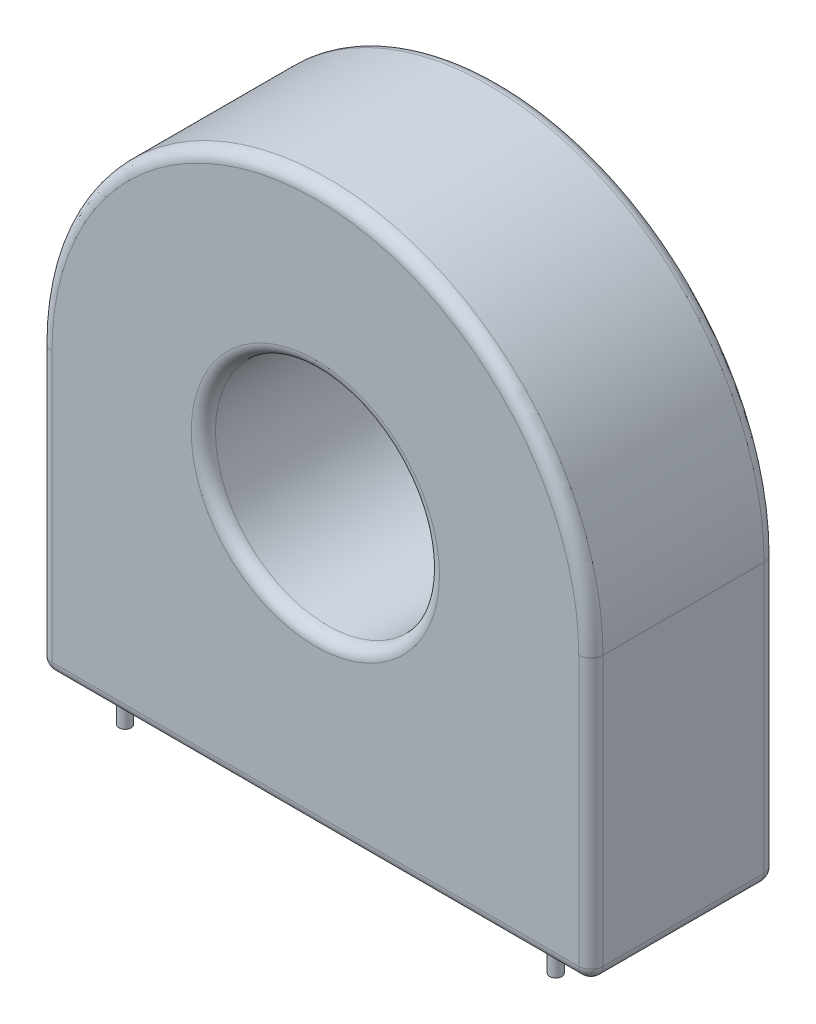
from build123d import *

# Parameters (mm, degrees)
SKETCH1_R           = 9.25
BOSS_EXTRUDE1_DEPTH = 7.65
SKETCH2_R           = 0.5
BOSS_EXTRUDE2_DEPTH = 2.5
FILLET1_R           = 1
SKETCH3_W           = 0.895944424
SKETCH3_H           = 4
SKETCH3_W_2         = 1.965215774
SKETCH3_H_2         = 0.500882695
CUT_EXTRUDE1_DEPTH  = 0.01
SKETCH4_W           = 0.682539037
SKETCH4_H           = 0.809522518
SKETCH4_W_2         = 0.682539036
SKETCH4_H_2         = 0.809522517
CUT_EXTRUDE2_DEPTH  = 0.01


with BuildPart() as part:
    # Sketch1 → Boss-Extrude1 (new, symmetric)
    with BuildSketch(Plane.XY):
        with BuildLine():
            Line((-22.75, 11.625), (-22.75, -11.625))
            Line((-22.75, -11.625), (22.75, -11.625))
            Line((22.75, -11.625), (22.75, 11.625))
            ThreePointArc((22.75, 11.625), (0, 34.375), (-22.75, 11.625))
        make_face()
        with Locations((0, 11.625)):
            Circle(SKETCH1_R, mode=Mode.SUBTRACT)
    extrude(amount=BOSS_EXTRUDE1_DEPTH, both=True)

    # Sketch2 → Boss-Extrude2 (add, symmetric)
    with BuildSketch(Plane.XZ.offset(11.625)):
        with Locations((17.78, 5.58)):
            Circle(SKETCH2_R)
        with Locations((0, -4.58)):
            Circle(SKETCH2_R)
        with Locations((-17.78, 5.58)):
            Circle(SKETCH2_R)
    extrude(amount=BOSS_EXTRUDE2_DEPTH, both=True)

    # Fillet1
    fillet1_edges = [part.edges().sort_by_distance(p)[0] for p in [
        (-22.75, 0, -7.65),
        (0, 34.375, -7.65),
        (22.75, 0, 7.65),
        (-22.75, 0, 7.65),
        (-22.75, -11.625, 0),
        (22.75, -11.625, 0),
        (0, -11.625, -7.65),
        (0, -11.625, 7.65),
        (22.75, 0, -7.65),
        (0, 34.375, 7.65),
        (-9.25, 11.625, 7.65),
    ]]
    fillet(fillet1_edges, radius=FILLET1_R)

    # Sketch3 → Cut-Extrude1 (cut)
    # profile 1 of 17: a face of its own
    with BuildSketch(Plane.XY.offset(-7.65)):
        Polygon((-8.243385382, -3.852442817), (-9.139329806, -3.852442817), (-9.139329806, -0.943216627), (-11.623966601, -3.852442817), (-12.582009721, -3.852442817), (-12.582009721, 0.147557183), (-11.686065297, 0.147557183), (-11.686065297, -2.761482996), (-9.201445726, 0.147557183), (-8.243385382, 0.147557183), align=None)
    # profile 2 of 17: a face of its own
    with BuildSketch(Plane.XY.offset(-7.65)):
        with Locations((-7.393297629, -1.852442817)):
            Rectangle(SKETCH3_W, SKETCH3_H)
    # profile 3 of 17: a face of its own
    with BuildSketch(Plane.XY.offset(-7.65)):
        Polygon((-2.768958574, -3.852441956), (-6.834476962, -3.852441956), (-6.834476962, -3.351560122), (-3.664902998, -3.351560122), (-3.664902998, 0.147557183), (-2.768958574, 0.147557183), align=None)
    # profile 4 of 17: a face of its own
    with BuildSketch(Plane.XY.offset(-7.65)):
        with Locations((-0.282186518, -1.852442817)):
            Rectangle(SKETCH3_W, SKETCH3_H)
    # profile 5 of 17: a face of its own
    with BuildSketch(Plane.XY.offset(-7.65)):
        Polygon((5.244161293, -3.852442817), (4.329861111, -3.852442817), (3.769090333, -2.723695022), (1.66010458, -2.723695022), (1.099333802, -3.852442817), (0.18503362, -3.852442817), (2.19649402, 0.147557183), (3.232700893, 0.147557183), align=None)
        Polygon((3.506990947, -2.222812327), (2.714597456, -0.642503409), (1.922203965, -2.222812327), align=None, mode=Mode.SUBTRACT)
    # profile 6 of 17: a face of its own
    with BuildSketch(Plane.XY.offset(-7.65)):
        Polygon((9.590829785, -3.852442817), (8.694885362, -3.852442817), (8.694885362, -1.877134176), (6.14814987, -1.877134176), (6.14814987, -3.852442817), (5.252205447, -3.852442817), (5.252205447, 0.147557183), (6.14814987, 0.147557183), (6.14814987, -1.37625148), (8.694885362, -1.37625148), (8.694885362, 0.147557183), (9.590829785, 0.147557183), align=None)
    # profile 7 of 17: a face of its own
    with BuildSketch(Plane.XY.offset(-7.65)):
        Polygon((14.532518498, -0.353325513), (12.582011443, -0.353325513), (12.582011443, -3.852442817), (11.686067881, -3.852442817), (11.686067881, -0.353325513), (9.735560826, -0.353325513), (9.735560826, 0.147557183), (14.532518498, 0.147557183), align=None)
    # profile 8 of 17: a face of its own
    with BuildSketch(Plane.XY.offset(-7.65)):
        with BuildLine():
            add(Edge.make_bspline(
                [(-14.092768959, -8.387409611), (-14.093682359, -8.416798847), (-14.095444674, -8.473502486), (-14.107040039, -8.555298605), (-14.125683506, -8.631229451), (-14.151024529, -8.701754478), (-14.183558361, -8.767078187), (-14.224942542, -8.825300742), (-14.271907298, -8.879214637), (-14.326767489, -8.926585214), (-14.38808482, -8.967933996), (-14.454750326, -9.004373318), (-14.52729125, -9.03541708), (-14.606060265, -9.059642085), (-14.69033939, -9.079109265), (-14.780196049, -9.093183874), (-14.875991171, -9.100984664), (-14.941667322, -9.101946627), (-14.975485009, -9.102441956)],
                knots=[0, 0, 0, 0, 1.091324182, 2.105602559, 3.061388645, 3.990302777, 4.883708783, 5.761913066, 6.63583257, 7.533363956, 8.444729669, 9.377803759, 10.351071984, 11.369571165, 12.434066396, 13.5611468, 14.744196001, 16, 16, 16, 16], degree=3))
            Line((-14.975485009, -9.102441956), (-16.973509493, -9.102441956))
            add(Edge.make_bspline(
                [(-16.973509493, -9.102441956), (-17.007103675, -9.101941333), (-17.072556098, -9.100965956), (-17.168128459, -9.093184015), (-17.25798513, -9.079109231), (-17.342264241, -9.05964209), (-17.421033297, -9.03541709), (-17.493574078, -9.004373278), (-17.560240087, -8.96793414), (-17.621555608, -8.926584691), (-17.676422367, -8.879216537), (-17.723363266, -8.825293838), (-17.76483693, -8.767104304), (-17.797071266, -8.701561929), (-17.823788355, -8.631435435), (-17.842083583, -8.555267841), (-17.853747393, -8.473757651), (-17.855521593, -8.417298834), (-17.85643739, -8.388156242)],
                knots=[0, 0, 0, 0, 1.248585623, 2.432652029, 3.560701514, 4.626112014, 5.645486916, 6.619591972, 7.553468334, 8.465617653, 9.36392075, 10.238591664, 11.11755104, 12.011725211, 12.945218025, 13.90182591, 14.916976379, 16, 16, 16, 16], degree=3))
            Line((-17.85643739, -8.388156242), (-17.856440834, -5.817603477))
            add(Edge.make_bspline(
                [(-17.856440834, -5.817603477), (-17.855523491, -5.788462915), (-17.853746238, -5.732006206), (-17.842083798, -5.650497895), (-17.8237883, -5.574330315), (-17.797071279, -5.504203818), (-17.764836926, -5.438661443), (-17.723363267, -5.380471908), (-17.676422367, -5.32654921), (-17.621555608, -5.279181056), (-17.560240087, -5.237831606), (-17.493574078, -5.201392469), (-17.421033297, -5.170348655), (-17.342264241, -5.146123665), (-17.257985128, -5.126656481), (-17.168128465, -5.112581873), (-17.072333344, -5.104781083), (-17.006657193, -5.10381912), (-16.972839506, -5.103323791)],
                knots=[0, 0, 0, 0, 1.082394717, 2.097023559, 3.053139899, 3.986153045, 4.879867752, 5.758375482, 6.632596953, 7.530438465, 8.442119083, 9.37551558, 10.3491201, 11.367971205, 12.432834253, 13.560304098, 14.743762081, 16, 16, 16, 16], degree=3))
            Line((-16.972839506, -5.103323791), (-14.975689966, -5.102442817))
            add(Edge.make_bspline(
                [(-14.975689966, -5.102442817), (-14.941806362, -5.10331105), (-14.876074911, -5.104995352), (-14.780194387, -5.11252725), (-14.690339799, -5.126669955), (-14.606060162, -5.146120303), (-14.527291275, -5.170349507), (-14.45475032, -5.201392218), (-14.388084821, -5.237831805), (-14.326767488, -5.279180519), (-14.271907299, -5.326551114), (-14.22494254, -5.380465004), (-14.183558371, -5.43868756), (-14.151024493, -5.504011269), (-14.12568365, -5.574536294), (-14.107039472, -5.65046715), (-14.095481961, -5.73201659), (-14.093692588, -5.788469804), (-14.092768959, -5.817609505)],
                knots=[0, 0, 0, 0, 1.259172173, 2.442692089, 3.570220939, 4.635139714, 5.654044138, 6.627699609, 7.561144954, 8.472873283, 9.370761781, 10.245029003, 11.123582708, 12.017344185, 12.946627916, 13.902794293, 14.917476233, 16, 16, 16, 16], degree=3))
            Line((-14.092768959, -5.817609505), (-14.092768959, -8.387409611))
        make_face()
        with BuildLine():
            Line((-14.921694844, -8.418002541), (-14.921694844, -5.787010546))
            add(Edge.make_bspline(
                [(-14.921694844, -5.787010546), (-14.922552419, -5.772712006), (-14.924186458, -5.745467314), (-14.936173859, -5.707682312), (-14.953640843, -5.675085245), (-14.978500578, -5.648802462), (-15.009079361, -5.628002708), (-15.046310566, -5.614310691), (-15.089384151, -5.605145539), (-15.120343035, -5.604532632), (-15.13686067, -5.604205625)],
                knots=[0, 0, 0, 0, 1.068687892, 2.03629688, 2.942648866, 3.814683618, 4.718091592, 5.68670121, 6.765775135, 8, 8, 8, 8], degree=3))
            Line((-15.13686067, -5.604205625), (-16.811524126, -5.603325513))
            add(Edge.make_bspline(
                [(-16.811524126, -5.603325513), (-16.82802163, -5.604015565), (-16.858944314, -5.60530899), (-16.902236935, -5.614455591), (-16.939920748, -5.627778683), (-16.970720504, -5.648813863), (-16.995487187, -5.675102237), (-17.013313351, -5.707522083), (-17.023699745, -5.7458961), (-17.02619132, -5.773161473), (-17.027513228, -5.787627142)],
                knots=[0, 0, 0, 0, 1.229193561, 2.303982665, 3.289199236, 4.189019928, 5.057591977, 5.960344992, 6.917859159, 8, 8, 8, 8], degree=3))
            Line((-17.027513228, -5.787627142), (-17.02751495, -8.418002541))
            add(Edge.make_bspline(
                [(-17.02751495, -8.418002541), (-17.02619583, -8.432514035), (-17.023713126, -8.459826005), (-17.01331298, -8.498243414), (-16.995487323, -8.530664262), (-16.970720311, -8.556949177), (-16.939921439, -8.577998001), (-16.902234004, -8.591263307), (-16.858955334, -8.600660893), (-16.827986688, -8.60124727), (-16.811463845, -8.601560122)],
                knots=[0, 0, 0, 0, 1.085029602, 2.042125889, 2.944484921, 3.812677906, 4.712105896, 5.696892497, 6.771212539, 8, 8, 8, 8], degree=3))
            Line((-16.811463845, -8.601560122), (-15.137675333, -8.601560122))
            add(Edge.make_bspline(
                [(-15.137675333, -8.601560122), (-15.120884586, -8.601250355), (-15.089651388, -8.600674144), (-15.046310398, -8.591455672), (-15.009079392, -8.577762891), (-14.978500598, -8.55696333), (-14.953640732, -8.530680458), (-14.936174313, -8.498083577), (-14.924122164, -8.460101229), (-14.922532857, -8.432645352), (-14.921694844, -8.418002541)],
                knots=[0, 0, 0, 0, 1.248967675, 2.323258931, 3.287575479, 4.186979369, 5.05514909, 5.957483945, 6.920804297, 8, 8, 8, 8], degree=3))
        make_face(mode=Mode.SUBTRACT)
    # profile 9 of 17: a face of its own
    with BuildSketch(Plane.XY.offset(-7.65)):
        with BuildLine():
            add(Edge.make_bspline(
                [(-10.091358025, -8.387409611), (-10.092271424, -8.416798847), (-10.094033739, -8.473502486), (-10.105629104, -8.555298605), (-10.124272571, -8.631229451), (-10.149613594, -8.701754478), (-10.182147427, -8.767078187), (-10.223531608, -8.825300742), (-10.270496363, -8.879214637), (-10.325356554, -8.926585214), (-10.386673885, -8.967933996), (-10.453339391, -9.004373318), (-10.525880315, -9.03541708), (-10.60464933, -9.059642085), (-10.688928455, -9.079109265), (-10.778785114, -9.093183874), (-10.874580236, -9.100984664), (-10.940256387, -9.101946627), (-10.974074074, -9.102441956)],
                knots=[0, 0, 0, 0, 1.091324182, 2.105602559, 3.061388645, 3.990302777, 4.883708783, 5.761913066, 6.63583257, 7.533363956, 8.444729669, 9.377803759, 10.351071984, 11.369571165, 12.434066396, 13.5611468, 14.744196001, 16, 16, 16, 16], degree=3))
            Line((-10.974074074, -9.102441956), (-12.972098559, -9.102441956))
            add(Edge.make_bspline(
                [(-12.972098559, -9.102441956), (-13.00569274, -9.101941333), (-13.071145163, -9.100965956), (-13.166717524, -9.093184015), (-13.256574195, -9.079109231), (-13.340853306, -9.05964209), (-13.419622363, -9.03541709), (-13.492163143, -9.004373278), (-13.558829153, -8.96793414), (-13.620144673, -8.926584691), (-13.675011432, -8.879216537), (-13.721952331, -8.825293838), (-13.763425995, -8.767104304), (-13.795660331, -8.701561929), (-13.82237742, -8.631435435), (-13.840672649, -8.555267841), (-13.852336458, -8.473757651), (-13.854110658, -8.417298834), (-13.855026455, -8.388156242)],
                knots=[0, 0, 0, 0, 1.248585623, 2.432652029, 3.560701514, 4.626112014, 5.645486916, 6.619591972, 7.553468334, 8.465617653, 9.36392075, 10.238591664, 11.11755104, 12.011725211, 12.945218025, 13.90182591, 14.916976379, 16, 16, 16, 16], degree=3))
            Line((-13.855026455, -8.388156242), (-13.8550299, -5.817603477))
            add(Edge.make_bspline(
                [(-13.8550299, -5.817603477), (-13.854112557, -5.788462915), (-13.852335303, -5.732006206), (-13.840672863, -5.650497895), (-13.822377366, -5.574330315), (-13.795660345, -5.504203818), (-13.763425991, -5.438661443), (-13.721952332, -5.380471908), (-13.675011432, -5.32654921), (-13.620144673, -5.279181056), (-13.558829153, -5.237831606), (-13.492163143, -5.201392469), (-13.419622363, -5.170348655), (-13.340853307, -5.146123665), (-13.256574193, -5.126656481), (-13.16671753, -5.112581873), (-13.070922409, -5.104781083), (-13.005246258, -5.10381912), (-12.971428571, -5.103323791)],
                knots=[0, 0, 0, 0, 1.082394717, 2.097023559, 3.053139899, 3.986153045, 4.879867752, 5.758375482, 6.632596953, 7.530438465, 8.442119083, 9.37551558, 10.3491201, 11.367971205, 12.432834253, 13.560304098, 14.743762081, 16, 16, 16, 16], degree=3))
            Line((-12.971428571, -5.103323791), (-10.974279032, -5.102442817))
            add(Edge.make_bspline(
                [(-10.974279032, -5.102442817), (-10.940395427, -5.10331105), (-10.874663976, -5.104995352), (-10.778783452, -5.11252725), (-10.688928865, -5.126669955), (-10.604649228, -5.146120303), (-10.52588034, -5.170349507), (-10.453339385, -5.201392218), (-10.386673887, -5.237831805), (-10.325356553, -5.279180519), (-10.270496364, -5.326551114), (-10.223531605, -5.380465004), (-10.182147436, -5.43868756), (-10.149613558, -5.504011269), (-10.124272715, -5.574536294), (-10.105628537, -5.65046715), (-10.094071026, -5.73201659), (-10.092281653, -5.788469804), (-10.091358025, -5.817609505)],
                knots=[0, 0, 0, 0, 1.259172173, 2.442692089, 3.570220939, 4.635139714, 5.654044138, 6.627699609, 7.561144954, 8.472873283, 9.370761781, 10.245029003, 11.123582708, 12.017344185, 12.946627916, 13.902794293, 14.917476233, 16, 16, 16, 16], degree=3))
            Line((-10.091358025, -5.817609505), (-10.091358025, -8.387409611))
        make_face()
        with BuildLine():
            Line((-10.920283909, -8.418002541), (-10.920283909, -5.787010546))
            add(Edge.make_bspline(
                [(-10.920283909, -5.787010546), (-10.921141484, -5.772712006), (-10.922775523, -5.745467314), (-10.934762925, -5.707682312), (-10.952229908, -5.675085245), (-10.977089643, -5.648802462), (-11.007668426, -5.628002708), (-11.044899632, -5.614310691), (-11.087973216, -5.605145539), (-11.1189321, -5.604532632), (-11.135449735, -5.604205625)],
                knots=[0, 0, 0, 0, 1.068687892, 2.03629688, 2.942648866, 3.814683618, 4.718091592, 5.68670121, 6.765775135, 8, 8, 8, 8], degree=3))
            Line((-11.135449735, -5.604205625), (-12.810113192, -5.603325513))
            add(Edge.make_bspline(
                [(-12.810113192, -5.603325513), (-12.826610696, -5.604015565), (-12.857533379, -5.60530899), (-12.900826, -5.614455591), (-12.938509813, -5.627778683), (-12.969309569, -5.648813863), (-12.994076253, -5.675102237), (-13.011902417, -5.707522083), (-13.02228881, -5.7458961), (-13.024780385, -5.773161473), (-13.026102293, -5.787627142)],
                knots=[0, 0, 0, 0, 1.229193561, 2.303982665, 3.289199236, 4.189019928, 5.057591977, 5.960344992, 6.917859159, 8, 8, 8, 8], degree=3))
            Line((-13.026102293, -5.787627142), (-13.026104015, -8.418002541))
            add(Edge.make_bspline(
                [(-13.026104015, -8.418002541), (-13.024784896, -8.432514035), (-13.022302191, -8.459826005), (-13.011902045, -8.498243414), (-12.994076389, -8.530664262), (-12.969309376, -8.556949177), (-12.938510504, -8.577998001), (-12.900823069, -8.591263307), (-12.857544399, -8.600660893), (-12.826575753, -8.60124727), (-12.81005291, -8.601560122)],
                knots=[0, 0, 0, 0, 1.085029602, 2.042125889, 2.944484921, 3.812677906, 4.712105896, 5.696892497, 6.771212539, 8, 8, 8, 8], degree=3))
            Line((-12.81005291, -8.601560122), (-11.136264399, -8.601560122))
            add(Edge.make_bspline(
                [(-11.136264399, -8.601560122), (-11.119473651, -8.601250355), (-11.088240453, -8.600674144), (-11.044899463, -8.591455672), (-11.007668457, -8.577762891), (-10.977089664, -8.55696333), (-10.952229797, -8.530680458), (-10.934763379, -8.498083577), (-10.922711229, -8.460101229), (-10.921121922, -8.432645352), (-10.920283909, -8.418002541)],
                knots=[0, 0, 0, 0, 1.248967675, 2.323258931, 3.287575479, 4.186979369, 5.05514909, 5.957483945, 6.920804297, 8, 8, 8, 8], degree=3))
        make_face(mode=Mode.SUBTRACT)
    # profile 10 of 17: a face of its own
    with BuildSketch(Plane.XY.offset(-7.65)):
        Polygon((-6.747720493, -5.603325513), (-7.839507034, -5.603325513), (-7.839507034, -9.102442817), (-8.668432919, -9.102442817), (-8.668432919, -5.102442817), (-6.747720493, -5.102442817), align=None)
    # profile 11 of 17: a face of its own
    with BuildSketch(Plane.XY.offset(-7.65)):
        with Locations((-4.929806858, -7.441066726)):
            Rectangle(SKETCH3_W_2, SKETCH3_H_2)
    # profile 12 of 17: a face of its own
    with BuildSketch(Plane.XY.offset(-7.65)):
        with BuildLine():
            Line((-0.062433862, -9.102441956), (-2.943174396, -9.102441956))
            add(Edge.make_bspline(
                [(-2.943174396, -9.102441956), (-2.976768578, -9.101941333), (-3.042221001, -9.100965956), (-3.13779336, -9.093184015), (-3.227650038, -9.079109233), (-3.311929126, -9.059642082), (-3.390698265, -9.03541712), (-3.463238756, -9.004373172), (-3.529905784, -8.967934513), (-3.59121764, -8.926583343), (-3.646097698, -8.879221432), (-3.692990291, -8.825276058), (-3.734798666, -8.766957424), (-3.766268277, -8.701062772), (-3.793842135, -8.630980299), (-3.811573222, -8.554628837), (-3.823449348, -8.472886893), (-3.82519911, -8.416420771), (-3.826102293, -8.387274408)],
                knots=[0, 0, 0, 0, 1.247794276, 2.431110226, 3.558444758, 4.623180007, 5.641908834, 6.615396507, 7.548680983, 8.460252186, 9.357985943, 10.232102494, 11.11050479, 12.013864952, 12.936550513, 13.903155723, 14.917662794, 16, 16, 16, 16], degree=3))
            Line((-3.826102293, -8.387274408), (-3.826105737, -7.342130352))
            add(Edge.make_bspline(
                [(-3.826105737, -7.342130352), (-3.825194362, -7.313042769), (-3.823427062, -7.25663736), (-3.811620081, -7.174927589), (-3.793616474, -7.098392458), (-3.76672072, -7.028017), (-3.734505794, -6.962470097), (-3.693027214, -6.904281387), (-3.646087186, -6.850359776), (-3.59122188, -6.802986296), (-3.529899461, -6.76165761), (-3.463260618, -6.725137721), (-3.390529258, -6.694379354), (-3.31210164, -6.668858204), (-3.227716144, -6.649313706), (-3.137655444, -6.636986831), (-3.042063706, -6.627305701), (-2.976335586, -6.626609714), (-2.942504409, -6.62625148)],
                knots=[0, 0, 0, 0, 1.079603584, 2.093521595, 3.059565557, 3.99192505, 4.885013636, 5.762905899, 6.636514906, 7.533727405, 8.444769315, 9.377511891, 10.350434321, 11.371899559, 12.436016582, 13.561057118, 14.74464218, 16, 16, 16, 16], degree=3))
            Line((-2.942504409, -6.62625148), (-0.891359747, -6.62625148))
            Line((-0.891359747, -6.62625148), (-0.891359747, -5.603325513))
            Line((-0.891359747, -5.603325513), (-3.605051257, -5.603325513))
            Line((-3.605051257, -5.603325513), (-3.605051257, -5.102442817))
            Line((-3.605051257, -5.102442817), (-0.062433862, -5.102442817))
            Line((-0.062433862, -5.102442817), (-0.062433862, -7.127134176))
            Line((-0.062433862, -7.127134176), (-2.781189029, -7.127134176))
            add(Edge.make_bspline(
                [(-2.781189029, -7.127134176), (-2.797679997, -7.127833524), (-2.82859041, -7.129144371), (-2.871963862, -7.138180282), (-2.909228473, -7.151811502), (-2.940980804, -7.171619732), (-2.964826556, -7.198943809), (-2.983041164, -7.231267482), (-2.993346074, -7.269724557), (-2.995849785, -7.29697756), (-2.997178131, -7.311436665)],
                knots=[0, 0, 0, 0, 1.228569347, 2.302811313, 3.287526345, 4.174798407, 5.059089855, 5.961383309, 6.918410039, 8, 8, 8, 8], degree=3))
            Line((-2.997178131, -7.311436665), (-2.997179853, -8.417253326))
            add(Edge.make_bspline(
                [(-2.997179853, -8.417253326), (-2.995852085, -8.431715422), (-2.993349562, -8.458972994), (-2.983029314, -8.497407893), (-2.964868248, -8.529812795), (-2.940719274, -8.556964482), (-2.909540764, -8.577956677), (-2.871912747, -8.591275855), (-2.828616048, -8.600657094), (-2.797650133, -8.601245948), (-2.781128748, -8.601560122)],
                knots=[0, 0, 0, 0, 1.080018298, 2.035574722, 2.936481959, 3.819414846, 4.717395756, 5.700597943, 6.773189523, 8, 8, 8, 8], degree=3))
            Line((-2.781128748, -8.601560122), (-0.062433862, -8.601560122))
            Line((-0.062433862, -8.601560122), (-0.062433862, -9.102441956))
        make_face()
    # profile 13 of 17: a face of its own
    with BuildSketch(Plane.XY.offset(-7.65)):
        with Locations((1.09770637, -7.441066726)):
            Rectangle(SKETCH3_W_2, SKETCH3_H_2)
    # profile 14 of 17: a face of its own
    with BuildSketch(Plane.XY.offset(-7.65)):
        with BuildLine():
            add(Edge.make_bspline(
                [(5.965079365, -8.386535527), (5.964178551, -8.415925924), (5.962440446, -8.4726342), (5.95063423, -8.554660449), (5.932548182, -8.630769718), (5.906361096, -8.701259807), (5.874585792, -8.766930613), (5.832868082, -8.825283111), (5.785951405, -8.87921949), (5.731077978, -8.926583878), (5.669764295, -8.967934365), (5.603097775, -9.004373214), (5.530557139, -9.03541711), (5.451788042, -9.059642076), (5.36750894, -9.079109267), (5.277652274, -9.093183873), (5.181857154, -9.100984664), (5.116181002, -9.101946627), (5.082363316, -9.102441956)],
                knots=[0, 0, 0, 0, 1.090546724, 2.104191533, 3.069975193, 3.988060192, 4.890652559, 5.768308273, 6.641681885, 7.538652629, 8.449449058, 9.381940305, 10.354600579, 11.372463556, 12.436293852, 13.562670226, 14.744980438, 16, 16, 16, 16], degree=3))
            Line((5.082363316, -9.102441956), (3.084338831, -9.102441956))
            add(Edge.make_bspline(
                [(3.084338831, -9.102441956), (3.050744649, -9.101941333), (2.985292226, -9.100965956), (2.889719867, -9.093184015), (2.79986319, -9.079109233), (2.715584102, -9.059642082), (2.636814963, -9.03541712), (2.564274471, -9.004373172), (2.497607443, -8.967934513), (2.436295588, -8.926583343), (2.38141553, -8.879221432), (2.334522937, -8.825276058), (2.292714561, -8.766957424), (2.261244951, -8.701062772), (2.233671092, -8.630980299), (2.215940006, -8.554628837), (2.204063879, -8.472886893), (2.202314117, -8.416420771), (2.201410935, -8.387274408)],
                knots=[0, 0, 0, 0, 1.247794276, 2.431110226, 3.558444758, 4.623180007, 5.641908834, 6.615396507, 7.548680983, 8.460252186, 9.357985943, 10.232102494, 11.11050479, 12.013864952, 12.936550513, 13.903155723, 14.917662794, 16, 16, 16, 16], degree=3))
            Line((2.201410935, -8.387274408), (2.20140749, -7.342130352))
            add(Edge.make_bspline(
                [(2.20140749, -7.342130352), (2.202318865, -7.313042769), (2.204086166, -7.25663736), (2.215893147, -7.174927589), (2.233896753, -7.098392458), (2.260792507, -7.028017), (2.293007433, -6.962470097), (2.334486014, -6.904281387), (2.381426042, -6.850359776), (2.436291347, -6.802986296), (2.497613766, -6.76165761), (2.564252609, -6.725137721), (2.636983969, -6.694379354), (2.715411588, -6.668858204), (2.799797083, -6.649313706), (2.889857784, -6.636986831), (2.985449521, -6.627305701), (3.051177641, -6.626609714), (3.085008818, -6.62625148)],
                knots=[0, 0, 0, 0, 1.079603584, 2.093521595, 3.059565557, 3.99192505, 4.885013636, 5.762905899, 6.636514906, 7.533727405, 8.444769315, 9.377511891, 10.350434321, 11.371899559, 12.436016582, 13.561057118, 14.74464218, 16, 16, 16, 16], degree=3))
            Line((3.085008818, -6.62625148), (5.13615348, -6.62625148))
            Line((5.13615348, -6.62625148), (5.13615348, -6.037295593))
            add(Edge.make_bspline(
                [(5.13615348, -6.037295593), (5.134669543, -6.003911441), (5.131863069, -5.940774166), (5.109887248, -5.851914284), (5.071662187, -5.775539215), (5.016131625, -5.713430919), (4.945922492, -5.664285665), (4.860067415, -5.630843446), (4.760163091, -5.608269116), (4.688325623, -5.60561293), (4.65026455, -5.604205625)],
                knots=[0, 0, 0, 0, 1.078341341, 2.039396853, 2.936100315, 3.811247336, 4.704924793, 5.680758394, 6.771214737, 8, 8, 8, 8], degree=3))
            Line((4.65026455, -5.604205625), (2.477723008, -5.603325513))
            Line((2.477723008, -5.603325513), (2.477723008, -5.102442817))
            Line((2.477723008, -5.102442817), (4.866177869, -5.102442817))
            add(Edge.make_bspline(
                [(4.866177869, -5.102442817), (4.908269619, -5.103563399), (4.990162799, -5.105743589), (5.109341208, -5.114696909), (5.221051232, -5.132427713), (5.325501701, -5.157485777), (5.423722659, -5.187375359), (5.513734389, -5.226680498), (5.597083234, -5.271836678), (5.672845167, -5.32471404), (5.741022297, -5.384413088), (5.800067642, -5.451821757), (5.851043602, -5.526016104), (5.890766339, -5.608882975), (5.924528279, -5.697668163), (5.946261716, -5.794495207), (5.962237991, -5.897924134), (5.964114467, -5.969511356), (5.965079365, -6.006322027)],
                knots=[0, 0, 0, 0, 1.248360097, 2.428793654, 3.540639795, 4.597573295, 5.611896563, 6.58001487, 7.504387576, 8.418265567, 9.313545441, 10.184224061, 11.068921664, 11.973149494, 12.902398245, 13.878991678, 14.90936207, 16, 16, 16, 16], degree=3))
            Line((5.965079365, -6.006322027), (5.965079365, -8.386535527))
        make_face()
        with BuildLine():
            Line((5.13615348, -8.417253326), (5.13615348, -7.127134176))
            Line((5.13615348, -7.127134176), (3.246324198, -7.127134176))
            add(Edge.make_bspline(
                [(3.246324198, -7.127134176), (3.229833231, -7.127833524), (3.198922817, -7.129144371), (3.155549365, -7.138180282), (3.118284754, -7.151811502), (3.086532423, -7.171619732), (3.062686671, -7.198943809), (3.044472063, -7.231267482), (3.034167153, -7.269724557), (3.031663443, -7.29697756), (3.030335097, -7.311436665)],
                knots=[0, 0, 0, 0, 1.228569347, 2.302811313, 3.287526345, 4.174798407, 5.059089855, 5.961383309, 6.918410039, 8, 8, 8, 8], degree=3))
            Line((3.030335097, -7.311436665), (3.030333375, -8.417253326))
            add(Edge.make_bspline(
                [(3.030333375, -8.417253326), (3.031661142, -8.431715422), (3.034163665, -8.458972994), (3.044483913, -8.497407893), (3.062644979, -8.529812795), (3.086793953, -8.556964482), (3.117972463, -8.577956677), (3.155600481, -8.591275855), (3.19889718, -8.600657094), (3.229863094, -8.601245948), (3.24638448, -8.601560122)],
                knots=[0, 0, 0, 0, 1.080018298, 2.035574722, 2.936481959, 3.819414846, 4.717395756, 5.700597943, 6.773189523, 8, 8, 8, 8], degree=3))
            Line((3.24638448, -8.601560122), (4.920172991, -8.601560122))
            add(Edge.make_bspline(
                [(4.920172991, -8.601560122), (4.936962248, -8.601249004), (4.968192673, -8.600670281), (5.011551634, -8.591468092), (5.048724441, -8.577722577), (5.079681832, -8.556979089), (5.103925391, -8.529829418), (5.12172559, -8.497248415), (5.133711047, -8.459205719), (5.135310243, -8.431758791), (5.13615348, -8.417253326)],
                knots=[0, 0, 0, 0, 1.246449489, 2.318574743, 3.280947022, 4.178537522, 5.061086541, 5.961602094, 6.922980187, 8, 8, 8, 8], degree=3))
        make_face(mode=Mode.SUBTRACT)
    # profile 15 of 17: a face of its own
    with BuildSketch(Plane.XY.offset(-7.65)):
        Polygon((9.988555101, -5.603325513), (7.149910094, -5.603325513), (9.060536541, -9.102442817), (8.132517981, -9.102442817), (6.253964809, -5.603325513), (6.253964809, -5.102442817), (9.988555101, -5.102442817), align=None)
    # profile 16 of 17: a face of its own
    with BuildSketch(Plane.XY.offset(-7.65)):
        Polygon((13.685714286, -9.102441956), (10.018143395, -9.102441956), (10.018143395, -8.601560122), (12.856788401, -8.601560122), (12.856788401, -5.102442817), (13.685714286, -5.102442817), align=None)
    # profile 17 of 17: a face of its own
    with BuildSketch(Plane.XY.offset(-7.65)):
        Polygon((18.07948547, -5.603325513), (16.332627005, -5.603325513), (16.332627005, -9.102442817), (15.50370112, -9.102442817), (15.50370112, -5.603325513), (13.756842655, -5.603325513), (13.756842655, -5.102442817), (18.07948547, -5.102442817), align=None)
    extrude(amount=CUT_EXTRUDE1_DEPTH, mode=Mode.SUBTRACT)

    # Sketch4 → Cut-Extrude2 (cut)
    # profile 1 of 6: a face of its own
    with BuildSketch(Plane.XZ.offset(11.625)):
        Polygon((-18.436532062, 1.161328361), (-19.163141065, 1.161328361), (-19.163141065, 3.78566634), (-19.708097817, 3.78566634), (-19.708097817, 0.78566634), (-18.436532062, 0.78566634), align=None)
    # profile 2 of 6: a face of its own
    with BuildSketch(Plane.XZ.offset(11.625)):
        Polygon((-15.272495139, 3.023761578), (-15.781121441, 3.023761578), (-15.781121441, 3.78566634), (-16.241439547, 3.78566634), (-16.241439547, 3.023761578), (-16.923978584, 3.023761578), (-16.923978584, 3.78566634), (-17.384297336, 3.78566634), (-17.384297336, 3.023761578), (-17.892923638, 3.023761578), (-17.892923638, 2.690427599), (-17.384297336, 2.690427599), (-17.384297336, 1.880905081), (-17.892923638, 1.880905081), (-17.892923638, 1.547571102), (-17.384297336, 1.547571102), (-17.384297336, 0.78566634), (-16.923978584, 0.78566634), (-16.923978584, 1.547571102), (-16.241439547, 1.547571102), (-16.241439547, 0.78566634), (-15.781121441, 0.78566634), (-15.781121441, 1.547571102), (-15.272495139, 1.547571102), (-15.272495139, 1.880905081), (-15.781121441, 1.880905081), (-15.781121441, 2.690427599), (-15.272495139, 2.690427599), align=None)
        with Locations((-16.582709066, 2.28566634)):
            Rectangle(SKETCH4_W, SKETCH4_H, mode=Mode.SUBTRACT)
    # profile 3 of 6: a face of its own
    with BuildSketch(Plane.XZ.offset(11.625)):
        with BuildLine():
            Line((16.42627757, 3.785665694), (13.934230225, 3.785665694))
            Line((13.934230225, 3.785665694), (13.934230225, 3.410004318))
            Line((13.934230225, 3.410004318), (15.881320818, 3.410004318))
            Line((15.881320818, 3.410004318), (15.881320818, 2.442393641))
            add(Edge.make_bspline(
                [(15.881320818, 2.442393641), (15.880570172, 2.431330693), (15.879170616, 2.410704172), (15.871884245, 2.381898417), (15.859998017, 2.357674062), (15.843560801, 2.337919704), (15.823227227, 2.322030697), (15.798031124, 2.311858475), (15.769035257, 2.304890863), (15.748204618, 2.304429461), (15.737132527, 2.304184213)],
                knots=[0, 0, 0, 0, 1.168383886, 2.178415151, 3.114761772, 3.990479347, 4.869897153, 5.80768764, 6.834722204, 8, 8, 8, 8], degree=3))
            Line((15.737132527, 2.304184213), (14.515244222, 2.304184858))
            add(Edge.make_bspline(
                [(14.515244222, 2.304184858), (14.492844032, 2.303913138), (14.449372533, 2.303385817), (14.38636395, 2.296194587), (14.326983825, 2.286727695), (14.271502443, 2.272402718), (14.220070464, 2.252852298), (14.172227443, 2.229664337), (14.127852455, 2.20280682), (14.087617635, 2.171332708), (14.051870349, 2.135567208), (14.020436634, 2.095465719), (13.993661746, 2.050933071), (13.973020031, 2.001442532), (13.955305023, 1.948540897), (13.944041822, 1.890950388), (13.935527994, 1.829566741), (13.934665563, 1.787021412), (13.934222475, 1.765163048)],
                knots=[0, 0, 0, 0, 1.188285322, 2.306076078, 3.362203406, 4.378287727, 5.341092893, 6.277876351, 7.197026917, 8.088882973, 8.98250288, 9.874358936, 10.787456248, 11.730866857, 12.715190664, 13.743331781, 14.840599528, 16, 16, 16, 16], degree=3))
            Line((13.934222475, 1.765163048), (13.934230225, 1.32406811))
            add(Edge.make_bspline(
                [(13.934230225, 1.32406811), (13.934669451, 1.302195471), (13.935524097, 1.259635704), (13.9440423, 1.198238161), (13.955304902, 1.140647625), (13.973020068, 1.087746019), (13.993661712, 1.03825539), (14.020436732, 0.993723059), (14.051869998, 0.953620423), (14.087618949, 0.917859191), (14.1278475, 0.886369006), (14.172246724, 0.859573627), (14.219927372, 0.836179537), (14.271648661, 0.817582945), (14.327041389, 0.803328368), (14.386246192, 0.792551309), (14.44931751, 0.786777017), (14.492633088, 0.786043132), (14.514910305, 0.785665694)],
                knots=[0, 0, 0, 0, 1.160756192, 2.258598661, 3.287278292, 4.272117663, 5.216022406, 6.129597976, 7.021921163, 7.916009126, 8.808332313, 9.727964308, 10.665238429, 11.624484024, 12.641100546, 13.699789761, 14.817001044, 16, 16, 16, 16], degree=3))
            Line((14.514910305, 0.785665694), (16.244625319, 0.78566634))
            Line((16.244625319, 0.78566634), (16.244625319, 1.161328361))
            Line((16.244625319, 1.161328361), (14.623092375, 1.161328361))
            add(Edge.make_bspline(
                [(14.623092375, 1.161328361), (14.611903647, 1.16158698), (14.590964557, 1.16207097), (14.561631007, 1.168805574), (14.536777739, 1.179970144), (14.516261717, 1.195674155), (14.499864908, 1.215494681), (14.487826046, 1.239882171), (14.480823481, 1.268768003), (14.47932359, 1.289376062), (14.478534644, 1.300215959)],
                knots=[0, 0, 0, 0, 1.175204619, 2.199330993, 3.14391349, 4.020841102, 4.89407896, 5.827774186, 6.857403133, 8, 8, 8, 8], degree=3))
            Line((14.478534644, 1.300215959), (14.479186977, 1.789033285))
            add(Edge.make_bspline(
                [(14.479186977, 1.789033285), (14.479688257, 1.79986403), (14.480642929, 1.820490854), (14.488029023, 1.849438678), (14.499654002, 1.874238348), (14.516283368, 1.894166243), (14.536771431, 1.909882565), (14.561632961, 1.921043329), (14.590840294, 1.927751612), (14.611652334, 1.928255177), (14.622714538, 1.928522837)],
                knots=[0, 0, 0, 0, 1.137900938, 2.16709752, 3.121197092, 3.994068258, 4.870627628, 5.814813473, 6.838509792, 8, 8, 8, 8], degree=3))
            Line((14.622714538, 1.928522837), (15.845371434, 1.928522837))
            add(Edge.make_bspline(
                [(15.845371434, 1.928522837), (15.867503623, 1.928904128), (15.910673987, 1.929647862), (15.973600867, 1.935408335), (16.03280569, 1.946185534), (16.08819836, 1.960440107), (16.139919848, 1.979036591), (16.187599783, 2.002431097), (16.232001583, 2.029224965), (16.272220825, 2.060720614), (16.308004346, 2.096461554), (16.339191414, 2.13649113), (16.36639365, 2.180549483), (16.386647991, 2.229788875), (16.404681161, 2.282354593), (16.41571272, 2.339570131), (16.424368825, 2.400706371), (16.425196936, 2.443037678), (16.425624591, 2.464898498)],
                knots=[0, 0, 0, 0, 1.178342751, 2.298439003, 3.359862066, 4.379103791, 5.340826441, 6.280520881, 7.202527636, 8.097155065, 8.993551826, 9.888179255, 10.794055488, 11.740397672, 12.716623759, 13.747959744, 14.836996782, 16, 16, 16, 16], degree=3))
            Line((16.425624591, 2.464898498), (16.42627757, 3.785665694))
        make_face()
    # profile 4 of 6: a face of its own
    with BuildSketch(Plane.XZ.offset(11.625)):
        Polygon((19.131737666, 3.023761578), (18.623111363, 3.023761578), (18.623111363, 3.78566634), (18.162793257, 3.78566634), (18.162793257, 3.023761578), (17.480254221, 3.023761578), (17.480254221, 3.78566634), (17.019935468, 3.78566634), (17.019935468, 3.023761578), (16.511309166, 3.023761578), (16.511309166, 2.690427599), (17.019935468, 2.690427599), (17.019935468, 1.880905081), (16.511309166, 1.880905081), (16.511309166, 1.547571102), (17.019935468, 1.547571102), (17.019935468, 0.78566634), (17.480254221, 0.78566634), (17.480254221, 1.547571102), (18.162793257, 1.547571102), (18.162793257, 0.78566634), (18.623111363, 0.78566634), (18.623111363, 1.547571102), (19.131737666, 1.547571102), (19.131737666, 1.880905081), (18.623111363, 1.880905081), (18.623111363, 2.690427599), (19.131737666, 2.690427599), align=None)
        with Locations((17.821523739, 2.28566634)):
            Rectangle(SKETCH4_W_2, SKETCH4_H, mode=Mode.SUBTRACT)
    # profile 5 of 6: a face of its own
    with BuildSketch(Plane.XZ.offset(11.625)):
        with BuildLine():
            Line((0.068470519, -0.379493213), (-1.784382439, -0.379493213))
            add(Edge.make_bspline(
                [(-1.784382439, -0.379493213), (-1.806873855, -0.379761618), (-1.85043672, -0.380281483), (-1.913535932, -0.38748279), (-1.972916046, -0.396949737), (-2.02839739, -0.411274726), (-2.079829521, -0.430825053), (-2.127671997, -0.454013362), (-2.172048953, -0.480869618), (-2.212276659, -0.512348289), (-2.248050363, -0.548096859), (-2.279268389, -0.58811271), (-2.306247453, -0.632046778), (-2.32700778, -0.681081577), (-2.34458205, -0.733819548), (-2.355797817, -0.791190557), (-2.364412714, -0.852341249), (-2.365246702, -0.894670495), (-2.365677392, -0.91653025)],
                knots=[0, 0, 0, 0, 1.195173015, 2.314890322, 3.372837922, 4.3906735, 5.355138094, 6.293536131, 7.214270886, 8.107664086, 9.002824179, 9.896217379, 10.800843866, 11.735133181, 12.721153505, 13.751066659, 14.838601261, 16, 16, 16, 16], degree=3))
            Line((-2.365677392, -0.91653025), (-2.365669641, -1.584535169))
            add(Edge.make_bspline(
                [(-2.365669641, -1.584535169), (-2.364187967, -1.617000533), (-2.361398272, -1.678126278), (-2.346527644, -1.764152666), (-2.321824118, -1.838558768), (-2.286798166, -1.901362163), (-2.244270892, -1.952987001), (-2.198476054, -1.997161407), (-2.148578988, -2.033770202), (-2.112016281, -2.051326722), (-2.093851995, -2.060048769)],
                knots=[0, 0, 0, 0, 1.338248567, 2.519652672, 3.585454005, 4.553382934, 5.464210136, 6.331599572, 7.171141735, 8, 8, 8, 8], degree=3))
            add(Edge.make_bspline(
                [(-2.093851995, -2.060048769), (-2.112009075, -2.068778563), (-2.148557278, -2.086350677), (-2.198689738, -2.122930761), (-2.244249093, -2.16783698), (-2.286830318, -2.22007597), (-2.321654842, -2.283389471), (-2.346749032, -2.358318841), (-2.361260678, -2.444872432), (-2.364152293, -2.506422124), (-2.365677392, -2.538884748)],
                knots=[0, 0, 0, 0, 0.824792689, 1.660216872, 2.529624704, 3.443034264, 4.414115552, 5.474689096, 6.668097019, 8, 8, 8, 8], degree=3))
            Line((-2.365677392, -2.538884748), (-2.365669641, -2.841090797))
            add(Edge.make_bspline(
                [(-2.365669641, -2.841090797), (-2.365230415, -2.862963436), (-2.364375769, -2.905523203), (-2.355857566, -2.966920747), (-2.344594964, -3.024511283), (-2.326879798, -3.077412888), (-2.306238155, -3.126903517), (-2.279463134, -3.171435849), (-2.248029869, -3.211538485), (-2.212280918, -3.247299716), (-2.172052367, -3.278789901), (-2.127653142, -3.30558528), (-2.079972494, -3.328979371), (-2.028251206, -3.347575962), (-1.972858477, -3.361830539), (-1.913653674, -3.372607599), (-1.850582356, -3.37838189), (-1.807266778, -3.379115776), (-1.784989561, -3.379493213)],
                knots=[0, 0, 0, 0, 1.160756192, 2.258598661, 3.287278292, 4.272117663, 5.216022406, 6.129597976, 7.021921163, 7.916009126, 8.808332313, 9.727964308, 10.665238429, 11.624484024, 12.641100546, 13.699789761, 14.817001044, 16, 16, 16, 16], degree=3))
            Line((-1.784989561, -3.379493213), (0.068470519, -3.379492567))
            Line((0.068470519, -3.379492567), (0.068470519, -3.003830546))
            Line((0.068470519, -3.003830546), (-1.675391088, -3.003830546))
            add(Edge.make_bspline(
                [(-1.675391088, -3.003830546), (-1.686607282, -3.003550515), (-1.707785748, -3.003021759), (-1.737404184, -2.996464844), (-1.762501321, -2.985216682), (-1.782944681, -2.969275144), (-1.800112372, -2.949912598), (-1.812031164, -2.925240521), (-1.819088906, -2.896401534), (-1.820580591, -2.875786509), (-1.821365222, -2.864942949)],
                knots=[0, 0, 0, 0, 1.172495619, 2.213911402, 3.153694288, 4.026166056, 4.909860763, 5.838811697, 6.863208895, 8, 8, 8, 8], degree=3))
            Line((-1.821365222, -2.864942949), (-1.820712889, -2.376125623))
            add(Edge.make_bspline(
                [(-1.820712889, -2.376125623), (-1.820215882, -2.365291241), (-1.819269347, -2.344657492), (-1.811828012, -2.315756678), (-1.800328709, -2.290668301), (-1.782923228, -2.271202035), (-1.762507523, -2.255248522), (-1.737402214, -2.244004022), (-1.707940836, -2.237479452), (-1.686920914, -2.236926809), (-1.675862577, -2.23663607)],
                knots=[0, 0, 0, 0, 1.132583134, 2.156969924, 3.10661066, 3.99029639, 4.862759295, 5.802532633, 6.843937837, 8, 8, 8, 8], degree=3))
            Line((-1.675862577, -2.23663607), (-0.258503533, -2.23663607))
            Line((-0.258503533, -2.23663607), (-0.258503533, -1.860974049))
            Line((-0.258503533, -1.860974049), (-1.675391088, -1.860974049))
            add(Edge.make_bspline(
                [(-1.675391088, -1.860974049), (-1.686617569, -1.860716696), (-1.707815447, -1.860230761), (-1.737216907, -1.853406443), (-1.76265845, -1.843155087), (-1.782919736, -1.827028737), (-1.80012835, -1.807733409), (-1.811896286, -1.783225191), (-1.819179522, -1.754673663), (-1.820606687, -1.734258937), (-1.821365222, -1.723408557)],
                knots=[0, 0, 0, 0, 1.177167623, 2.222731914, 3.156821517, 4.032768801, 4.919983729, 5.852635165, 6.858680457, 8, 8, 8, 8], degree=3))
            Line((-1.821365222, -1.723408557), (-1.820712889, -0.893384686))
            add(Edge.make_bspline(
                [(-1.820712889, -0.893384686), (-1.82018456, -0.882761744), (-1.819169433, -0.862350923), (-1.812047265, -0.833700962), (-1.799875882, -0.809080688), (-1.783395346, -0.78899919), (-1.7622295, -0.773899926), (-1.737450519, -0.762464573), (-1.707926625, -0.756015024), (-1.686916016, -0.755451207), (-1.675862577, -0.755154589)],
                knots=[0, 0, 0, 0, 1.117053019, 2.146295154, 3.079639607, 3.985204058, 4.847889539, 5.792117174, 6.838458384, 8, 8, 8, 8], degree=3))
            Line((-1.675862577, -0.755154589), (0.068470519, -0.755154589))
            Line((0.068470519, -0.755154589), (0.068470519, -0.379493213))
        make_face()
    # profile 6 of 6: a face of its own
    with BuildSketch(Plane.XZ.offset(11.625)):
        Polygon((2.831837799, -1.141397329), (2.323211497, -1.141397329), (2.323211497, -0.379492567), (1.862893391, -0.379492567), (1.862893391, -1.141397329), (1.180354354, -1.141397329), (1.180354354, -0.379492567), (0.720035602, -0.379492567), (0.720035602, -1.141397329), (0.2114093, -1.141397329), (0.2114093, -1.474731309), (0.720035602, -1.474731309), (0.720035602, -2.284253826), (0.2114093, -2.284253826), (0.2114093, -2.617587806), (0.720035602, -2.617587806), (0.720035602, -3.379492567), (1.180354354, -3.379492567), (1.180354354, -2.617587806), (1.862893391, -2.617587806), (1.862893391, -3.379492567), (2.323211497, -3.379492567), (2.323211497, -2.617587806), (2.831837799, -2.617587806), (2.831837799, -2.284253826), (2.323211497, -2.284253826), (2.323211497, -1.474731309), (2.831837799, -1.474731309), align=None)
        with Locations((1.521623873, -1.879492568)):
            Rectangle(SKETCH4_W, SKETCH4_H_2, mode=Mode.SUBTRACT)
    extrude(amount=-CUT_EXTRUDE2_DEPTH, mode=Mode.SUBTRACT)


solid = part.part
